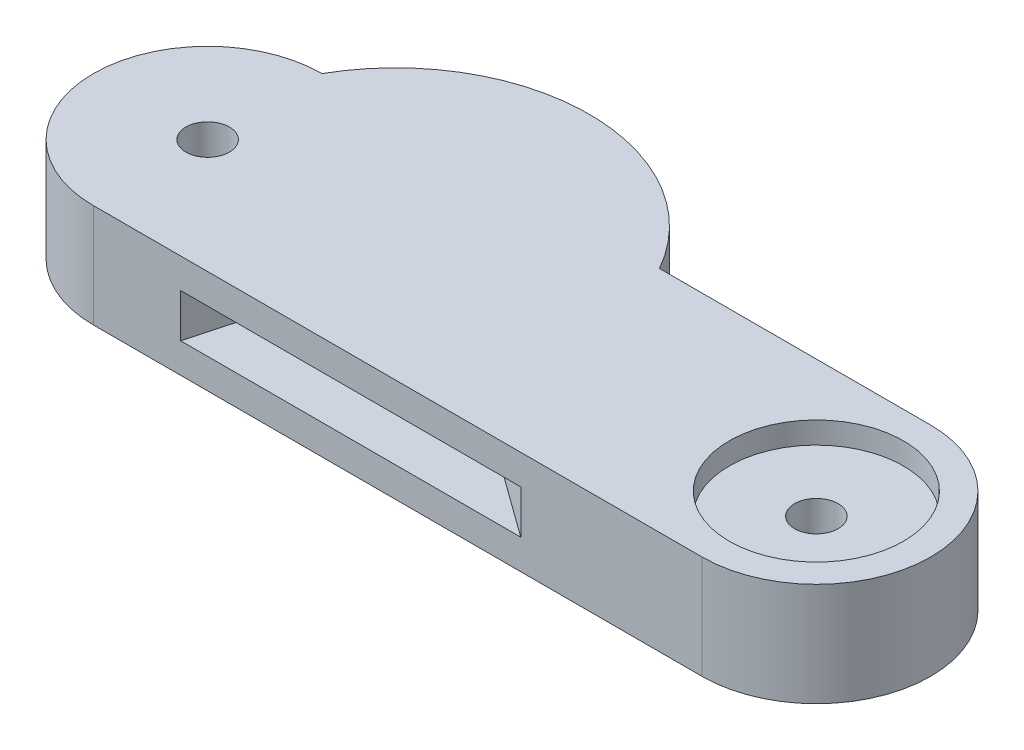
from build123d import *

# Parameters (mm, degrees)
SKETCH1_R                       = 2
BOSS_EXTRUDE1_DEPTH             = 4.75
CUT_EXTRUDE1_DEPTH              = 2
BOSS_EXTRUDE2_REACH             = 69.423
BOSS_EXTRUDE2_DIRECTION_2_REACH = 69.423
CUT_EXTRUDE2_DEPTH              = 2
SKETCH7_R                       = 8
CUT_EXTRUDE3_DEPTH              = 2


with BuildPart() as part:
    # Sketch1 → Boss-Extrude1 (new, symmetric)
    with BuildSketch(Plane(origin=(0, 0, 0), x_dir=(1, 0, 0), z_dir=(0, 1, 0))):
        with BuildLine():
            Line((0, -10.500399217), (-55.93053828, -10.500399217))
            ThreePointArc((-55.93053828, -10.500399217), (-66.430937497, 0), (-55.93053828, 10.500399217))
            Line((-55.93053828, 10.500399217), (0, 10.500399217))
            ThreePointArc((0, 10.500399217), (10.500399217, 0), (0, -10.500399217))
        make_face()
        Circle(SKETCH1_R, mode=Mode.SUBTRACT)
        with Locations((-55.93053828, 0)):
            Circle(SKETCH1_R, mode=Mode.SUBTRACT)
    extrude(amount=BOSS_EXTRUDE1_DEPTH, both=True)

    # Sketch3 → Cut-Extrude1 (cut, symmetric)
    with BuildSketch(Plane(origin=(0, 0, 0), x_dir=(1, 0, 0), z_dir=(0, 1, 0))):
        with BuildLine():
            Line((-35.751827911, 18.875253657), (-39.299525946, 5.868950542))
            Line((-39.299525946, 5.868950542), (26.645239155, -41.810424095))
            ThreePointArc((26.645239155, -41.810424095), (-18.563858299, -45.972421055), (-48.206523525, -11.584965354))
            Line((-48.206523525, -11.584965354), (-43.887265107, 4.249974277))
            Line((-43.887265107, 4.249974277), (-54.812276631, 12.148974547))
            ThreePointArc((-54.812276631, 12.148974547), (-46.585078234, 19.204535889), (-35.751827911, 18.875253657))
        make_face()
    extrude(amount=CUT_EXTRUDE1_DEPTH, both=True, mode=Mode.SUBTRACT)

    # Boss-Extrude2: up to this face of the body (flat: up to its plane)
    boss_extrude2_end = Plane(part.part.faces().sort_by_distance((-27.96526914, 4.75, 0))[0])
    # Sketch5 → Boss-Extrude2 (add, up to the picked face)
    with BuildSketch(Plane(origin=(0, 0, 0), x_dir=(1, 0, 0), z_dir=(0, 1, 0)), mode=Mode.PRIVATE) as boss_extrude2_sk1:
        with BuildLine():
            ThreePointArc((-24.917700351, 10.500399217), (-40.424119316, 19.553005923), (-55.93053828, 10.500399217))
            Line((-55.93053828, 10.500399217), (-24.917700351, 10.500399217))
        make_face()
    boss_extrude2_tool1 = split(extrude(boss_extrude2_sk1.sketch, amount=BOSS_EXTRUDE2_REACH, mode=Mode.PRIVATE), bisect_by=boss_extrude2_end, keep=Keep.BOTH, mode=Mode.PRIVATE)
    add(boss_extrude2_tool1.solids().sort_by(Axis((-40.424119, 0, -14.214125), (0, 1, 0)))[0])

    # Boss-Extrude2 direction 2: up to this face of the body (flat: up to its plane)
    boss_extrude2_direction_2_end = Plane(part.part.faces().sort_by_distance((-27.96526914, -4.75, 0))[0])
    # Sketch5 → Boss-Extrude2 direction 2 (add, up to the picked face)
    with BuildSketch(Plane(origin=(0, 0, 0), x_dir=(1, 0, 0), z_dir=(0, 1, 0)), mode=Mode.PRIVATE) as boss_extrude2_direction_2_sk1:
        with BuildLine():
            ThreePointArc((-24.917700351, 10.500399217), (-40.424119316, 19.553005923), (-55.93053828, 10.500399217))
            Line((-55.93053828, 10.500399217), (-24.917700351, 10.500399217))
        make_face()
    boss_extrude2_direction_2_tool1 = split(extrude(boss_extrude2_direction_2_sk1.sketch, amount=-BOSS_EXTRUDE2_DIRECTION_2_REACH, mode=Mode.PRIVATE), bisect_by=boss_extrude2_direction_2_end, keep=Keep.BOTH, mode=Mode.PRIVATE)
    add(boss_extrude2_direction_2_tool1.solids().sort_by(Axis((-40.424119, 0, -14.214125), (0, -1, 0)))[0])

    # Sketch6 → Cut-Extrude2 (cut, symmetric)
    with BuildSketch(Plane(origin=(0, 0, 0), x_dir=(1, 0, 0), z_dir=(0, 1, 0))):
        with BuildLine():
            Line((-39.299525946, 5.868950542), (-16.659276721, -10.500399217))
            Line((-16.659276721, -10.500399217), (-47.910689027, -10.500399217))
            Line((-47.910689027, -10.500399217), (-43.887265107, 4.249974277))
            Line((-43.887265107, 4.249974277), (-54.854382526, 12.179417945))
            ThreePointArc((-54.854382526, 12.179417945), (-46.349897212, 18.538096729), (-35.738154791, 18.925381021))
            Line((-35.738154791, 18.925381021), (-39.299525946, 5.868950542))
        make_face()
    extrude(amount=CUT_EXTRUDE2_DEPTH, both=True, mode=Mode.SUBTRACT)

    # Sketch7 → Cut-Extrude3 (cut)
    with BuildSketch(Plane(origin=(0, 4.75, 0), x_dir=(1, 0, 0), z_dir=(0, 1, 0))):
        Circle(SKETCH7_R)
    extrude(amount=-CUT_EXTRUDE3_DEPTH, mode=Mode.SUBTRACT)


solid = part.part
